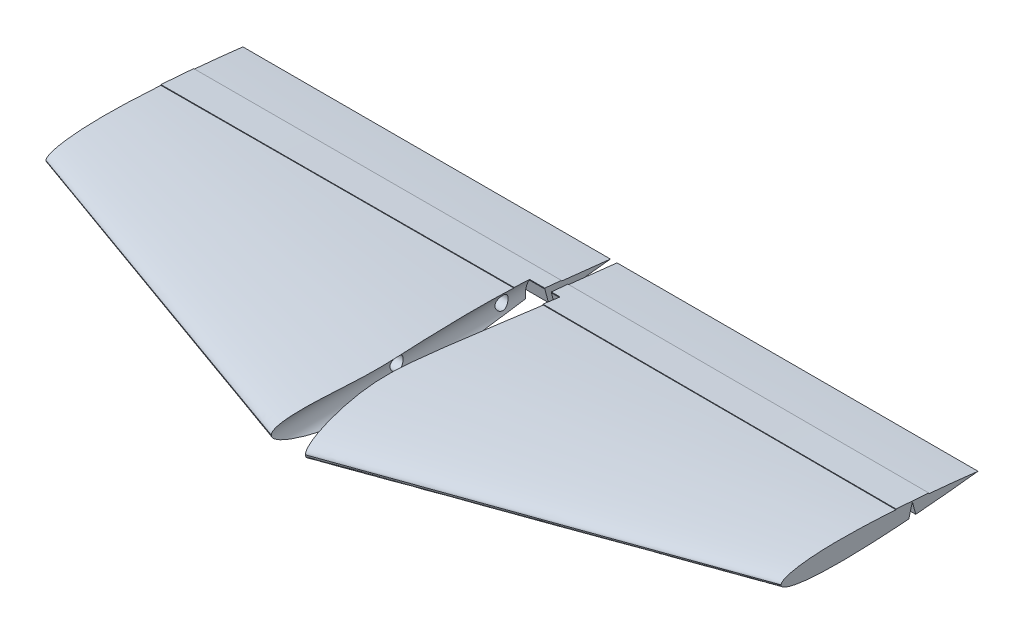
from build123d import *

# Parameters (mm, degrees)
CUT_EXTRUDE6_DEPTH      = 376.574578308
CUT_EXTRUDE6_DEPTH_BACK = 376.574578308
SKETCH14_W              = 10
SKETCH14_H              = 75
CUT_EXTRUDE7_START      = -376.574578308
SKETCH17_W              = 44
SKETCH17_H              = 44
CUT_EXTRUDE7_DEPTH      = 381.574578308
SKETCH8_R               = 5
CUT_EXTRUDE10_DEPTH     = 100
SKETCH18_R              = 5
CUT_EXTRUDE11_DEPTH     = 150
SKETCH13_R              = 13
CUT_EXTRUDE5_DEPTH      = 345.320002122


with BuildPart() as part:
    # Sketch3 → Loft1 section 0
    with BuildSketch(Plane(origin=(0, 0, 0), x_dir=(0, 0, -1), z_dir=(1, 0, 0))):
        with BuildLine():
            add(Edge.make_bspline(
                [(-250, 0), (-249.999895281, 0.195763361), (-249.961151424, 0.603923402), (-249.75955923, 1.263250946), (-249.128153903, 2.239806839), (-248.109823795, 3.175235862), (-246.576102635, 4.182773144), (-244.127109162, 5.366692622), (-240.073872734, 6.817923154), (-232.840047676, 8.611288496), (-221.29446773, 10.449653683), (-205.80771311, 11.81775272), (-187.49226418, 12.532505163), (-167.615673922, 12.562370188), (-147.96130587, 12.104155942), (-127.983093335, 11.220881059), (-108.565528946, 10.107332464), (-88.272495474, 8.647865064), (-69.457807346, 7.164126414), (-48.249165687, 5.205040487), (-31.044142862, 3.54737405), (-13.203762803, 1.558807082), (-4.467222804, 0.541092362), (0, 0)],
                knots=[0, 0, 0, 0, 0, 0.0027914, 0.005882719, 0.009734657, 0.016522403, 0.022438151, 0.032158027, 0.04863424, 0.078248652, 0.129036717, 0.199997011, 0.270957307, 0.341917602, 0.412877898, 0.483838194, 0.554798491, 0.625758787, 0.696719083, 0.767679379, 0.838639675, 0.909599973, 0.909599973, 0.909599973, 0.909599973, 0.909599973], degree=4))
            add(Edge.make_bspline(
                [(-250, 0), (-249.999895281, -0.195763361), (-249.961151424, -0.603923402), (-249.75955923, -1.263250946), (-249.128153903, -2.239806839), (-248.109823795, -3.175235862), (-246.576102635, -4.182773144), (-244.127109162, -5.366692622), (-240.073872734, -6.817923154), (-232.840047676, -8.611288496), (-221.29446773, -10.449653683), (-205.80771311, -11.81775272), (-187.49226418, -12.532505163), (-167.615673922, -12.562370188), (-147.96130587, -12.104155942), (-127.983093335, -11.220881059), (-108.565528946, -10.107332464), (-88.272495474, -8.647865064), (-69.457807346, -7.164126414), (-48.249165687, -5.205040487), (-31.044142862, -3.54737405), (-13.203762803, -1.558807082), (-4.467222803, -0.541092362), (0, 0)],
                knots=[0, 0, 0, 0, 0, 0.0027914, 0.005882719, 0.009734657, 0.016522403, 0.022438151, 0.032158027, 0.04863424, 0.078248652, 0.129036717, 0.199997011, 0.270957307, 0.341917602, 0.412877898, 0.483838194, 0.554798491, 0.625758787, 0.696719083, 0.767679379, 0.838639675, 0.909599973, 0.909599973, 0.909599973, 0.909599973, 0.909599973], degree=4))
        make_face()
    # Sketch4 → Loft1 section 1
    with BuildSketch(Plane(origin=(280, 0, 0), x_dir=(0, 0, -1), z_dir=(1, 0, 0))):
        with BuildLine():
            add(Edge.make_bspline(
                [(-150, 0), (-149.999937168, 0.117458016), (-149.976690854, 0.362354041), (-149.855735538, 0.757950568), (-149.476892342, 1.343884103), (-148.865894277, 1.905141517), (-147.945661581, 2.509663886), (-146.476265497, 3.220015573), (-144.04432364, 4.090753893), (-139.704028605, 5.166773097), (-132.776680638, 6.26979221), (-123.484627866, 7.090651632), (-112.495358508, 7.519503098), (-100.569404353, 7.537422113), (-88.776783522, 7.262493565), (-76.789856001, 6.732528635), (-65.139317368, 6.064399479), (-52.963497284, 5.188719038), (-41.674684407, 4.298475849), (-28.949499412, 3.123024292), (-18.626485717, 2.12842443), (-7.922257682, 0.935284249), (-2.680333682, 0.324655417), (0, 0)],
                knots=[0, 0, 0, 0, 0, 0.0027914, 0.005882719, 0.009734657, 0.016522403, 0.022438151, 0.032158027, 0.04863424, 0.078248652, 0.129036717, 0.199997011, 0.270957307, 0.341917602, 0.412877898, 0.483838194, 0.554798491, 0.625758787, 0.696719083, 0.767679379, 0.838639675, 0.909599973, 0.909599973, 0.909599973, 0.909599973, 0.909599973], degree=4))
            add(Edge.make_bspline(
                [(-150, 0), (-149.999937169, -0.117458016), (-149.976690854, -0.362354041), (-149.855735538, -0.757950568), (-149.476892342, -1.343884103), (-148.865894277, -1.905141517), (-147.945661581, -2.509663886), (-146.476265497, -3.220015573), (-144.04432364, -4.090753893), (-139.704028605, -5.166773097), (-132.776680638, -6.26979221), (-123.484627866, -7.090651632), (-112.495358508, -7.519503098), (-100.569404353, -7.537422113), (-88.776783522, -7.262493565), (-76.789856001, -6.732528635), (-65.139317368, -6.064399479), (-52.963497285, -5.188719038), (-41.674684407, -4.298475849), (-28.949499412, -3.123024292), (-18.626485717, -2.12842443), (-7.922257682, -0.935284249), (-2.680333682, -0.324655417), (0, 0)],
                knots=[0, 0, 0, 0, 0, 0.0027914, 0.005882719, 0.009734657, 0.016522403, 0.022438151, 0.032158027, 0.04863424, 0.078248652, 0.129036717, 0.199997011, 0.270957307, 0.341917602, 0.412877898, 0.483838194, 0.554798491, 0.625758787, 0.696719083, 0.767679379, 0.838639675, 0.909599973, 0.909599973, 0.909599973, 0.909599973, 0.909599973], degree=4))
        make_face()
    loft1 = loft()

    # Sketch6 → Cut-Loft1 section 0
    with BuildSketch(Plane.ZY):
        with BuildLine():
            Line((50, 5.222578378), (52.906464275, -5.624493968))
            Line((52.906464275, -5.624493968), (53.308388064, -7.124493968))
            Line((53.308388064, -7.124493968), (46.691611936, -7.124493968))
            Line((46.691611936, -7.124493968), (47.236267419, -5.091812034))
            Line((47.236267419, -5.091812034), (50, 5.222578378))
        make_face()
    # Sketch7 → Cut-Loft1 section 1
    with BuildSketch(Plane(origin=(280, 0, 0), x_dir=(0, 0, -1), z_dir=(1, 0, 0))):
        with BuildLine():
            Line((-50, 4.868494183), (-47.424974841, -4.741630539))
            Line((-47.424974841, -4.741630539), (-46.913435499, -6.650721356))
            Line((-46.913435499, -6.650721356), (-53.086564501, -6.650721356))
            Line((-53.086564501, -6.650721356), (-52.684640712, -5.150721356))
            Line((-52.684640712, -5.150721356), (-50, 4.868494183))
        make_face()
    cut_loft1 = loft(mode=Mode.SUBTRACT)

    # Sketch15 → Loft2 section 0
    with BuildSketch(Plane(origin=(280, 0, 0), x_dir=(0, 0, -1), z_dir=(1, 0, 0))):
        with BuildLine():
            Line((-62.5, 5.854103879), (-37.5, 3.899798493))
            Line((-37.5, 3.899798493), (-37.460913892, 4.399798493))
            Line((-37.460913892, 4.399798493), (-62.460913892, 6.354103879))
            Line((-62.460913892, 6.354103879), (-62.5, 5.854103879))
        make_face()
    # Sketch16 → Loft2 section 1
    with BuildSketch(Plane.ZY):
        with BuildLine():
            Line((37.435564177, 4.138141543), (62.435564177, 6.494023118))
            Line((62.435564177, 6.494023118), (62.388446545, 6.994023118))
            Line((62.388446545, 6.994023118), (37.388446545, 4.638141543))
            Line((37.388446545, 4.638141543), (37.435564177, 4.138141543))
        make_face()
    loft2 = loft()

    # Sketch14 → Cut-Extrude6 (cut, two sides: drawn at the far end of the back side and taken through both)
    with BuildSketch(Plane(origin=(0, 0, 0), x_dir=(1, 0, 0), z_dir=(0, 1, 0)).offset(-CUT_EXTRUDE6_DEPTH_BACK)):
        with Locations((0, -37.5)):
            Rectangle(SKETCH14_W, SKETCH14_H)
    extrude(amount=CUT_EXTRUDE6_DEPTH + CUT_EXTRUDE6_DEPTH_BACK, mode=Mode.SUBTRACT)

    # Sketch17 → Cut-Extrude7 (cut)
    with BuildSketch(Plane(origin=(0, 0, 0), x_dir=(1, 0, 0), z_dir=(0, 1, 0)).offset(CUT_EXTRUDE7_START)):
        with Locations((62, -102)):
            Rectangle(SKETCH17_W, SKETCH17_H)
        with Locations((-62, -102)):
            Rectangle(SKETCH17_W, SKETCH17_H)
    cut_extrude7 = extrude(amount=CUT_EXTRUDE7_DEPTH, mode=Mode.SUBTRACT)

    # Sketch8 → Cut-Extrude10 (cut)
    with BuildSketch(Plane.ZY):
        with Locations((70, 0)):
            Circle(SKETCH8_R)
    cut_extrude10 = extrude(amount=-CUT_EXTRUDE10_DEPTH, mode=Mode.SUBTRACT)

    # Sketch18 → Cut-Extrude11 (cut)
    with BuildSketch(Plane(origin=(0, 0, 0), x_dir=(0, 0, -1), z_dir=(1, 0, 0))):
        with Locations((-150, 0)):
            Circle(SKETCH18_R)
    cut_extrude11 = extrude(amount=CUT_EXTRUDE11_DEPTH, mode=Mode.SUBTRACT)

    # Mirror7: Loft1, Cut-Loft1, Loft2, Cut-Extrude7, Cut-Extrude10, Cut-Extrude11 across plane
    add(loft1.mirror(Plane(origin=(0, 0, 0), x_dir=(0, 0, 1), z_dir=(1, 0, 0))))
    add(cut_loft1.mirror(Plane(origin=(0, 0, 0), x_dir=(0, 0, 1), z_dir=(1, 0, 0))), mode=Mode.SUBTRACT)
    add(loft2.mirror(Plane(origin=(0, 0, 0), x_dir=(0, 0, 1), z_dir=(1, 0, 0))))
    add(cut_extrude7.mirror(Plane(origin=(0, 0, 0), x_dir=(0, 0, 1), z_dir=(1, 0, 0))), mode=Mode.SUBTRACT)
    add(cut_extrude10.mirror(Plane(origin=(0, 0, 0), x_dir=(0, 0, 1), z_dir=(1, 0, 0))), mode=Mode.SUBTRACT)
    add(cut_extrude11.mirror(Plane(origin=(0, 0, 0), x_dir=(0, 0, 1), z_dir=(1, 0, 0))), mode=Mode.SUBTRACT)

    # Sketch13 → Cut-Extrude5 (cut, through all)
    with BuildSketch(Plane.XY.offset(50)):
        Circle(SKETCH13_R)
    extrude(amount=CUT_EXTRUDE5_DEPTH, mode=Mode.SUBTRACT)


with BuildPart() as cut_extrude5_piece_1:
    # of the separate pieces the step leaves, piece 1, a body of its own (cut_extrude5_pieces)
    add(part.part.solids().sort_by_distance((-13, 0, 245.357142857))[0])


with BuildPart() as cut_extrude5_piece_2:
    # of the separate pieces the step leaves, piece 2, a body of its own (cut_extrude5_pieces)
    add(part.part.solids().sort_by_distance((13, 0, 245.357142857))[0])


solid = Compound([cut_extrude5_piece_1.part, cut_extrude5_piece_2.part])
